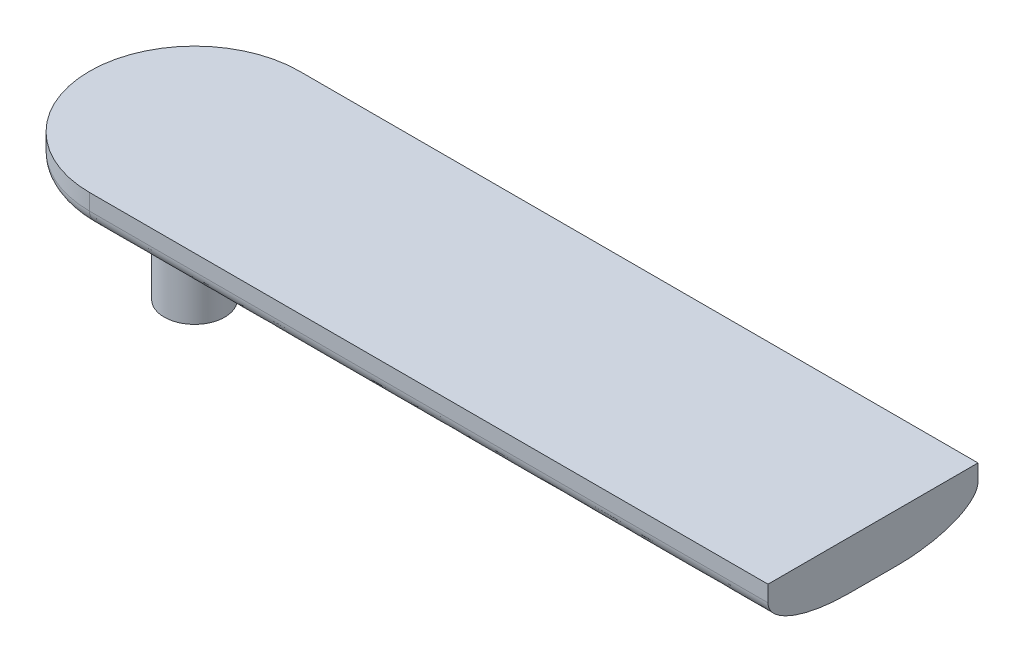
from build123d import *

# Parameters (mm, degrees)
BOSS_EXTRUDE1_DEPTH = 3
FILLET1_SIZE        = 2
FILLET1_SIZE_2      = 5
SKETCH2_R           = 1.875
SKETCH2_R_2         = 0.875
BOSS_EXTRUDE3_DEPTH = 9
CUT_EXTRUDE2_START  = -0.5
SKETCH4_R           = 0.875
CUT_EXTRUDE2_DEPTH  = 43.942490853


with BuildPart() as part:
    # Sketch1 → Boss-Extrude1 (new body)
    with BuildSketch(Plane(origin=(0, 0, 0), x_dir=(1, 0, 0), z_dir=(0, 1, 0))):
        with BuildLine():
            Line((0, 6.5), (42, 6.5))
            Line((42, 6.5), (42, -6.5))
            Line((42, -6.5), (0, -6.5))
            ThreePointArc((0, -6.5), (-6.5, 0), (0, 6.5))
        make_face()
    extrude(amount=BOSS_EXTRUDE1_DEPTH)

    # Fillet1
    # an asymmetric fillet: 5, 2 mm, written as the material it takes off along each edge
    with BuildSketch(Plane(origin=(0, 0, -6.5), x_dir=(0, 1, 0), z_dir=(1, 0, 0)), Plane(origin=(54.5, 0, 6.5), x_dir=(0, 1, 0), z_dir=(-1, 0, 0))) as fillet1_piece_1:
        with BuildLine():
            Bezier((FILLET1_SIZE, 0), (0, 0), (0, FILLET1_SIZE_2), weights=[1, 0.707106781, 1])
            Line((0, FILLET1_SIZE_2), (0, 0))
            Line((0, 0), (FILLET1_SIZE, 0))
        make_face()
    extrude(amount=54.5, mode=Mode.SUBTRACT)
    with BuildSketch(Plane(origin=(0, 0, 0), x_dir=(0, 0, 1), z_dir=(1, 0, 0))) as fillet1_piece_2:
        with BuildLine():
            Bezier((6.5, -FILLET1_SIZE), (6.5, 0), (6.5 - FILLET1_SIZE_2, 0), weights=[1, 0.707106781, 1])
            Line((6.5 - FILLET1_SIZE_2, 0), (6.5, 0))
            Line((6.5, 0), (6.5, -FILLET1_SIZE))
        make_face()
    revolve(axis=Axis((0, 0, 0), (0, -1, 0)), revolution_arc=180, mode=Mode.SUBTRACT)

    # Sketch2 → Boss-Extrude3 (add)
    with BuildSketch(Plane(origin=(0, 3, 0), x_dir=(1, 0, 0), z_dir=(0, 1, 0))):
        with Locations(Location((0, 0, 0), (0, 0, 270))):
            Circle(SKETCH2_R)
        with Locations(Location((0, 0, 0), (0, 0, 270))):
            Circle(SKETCH2_R_2, mode=Mode.SUBTRACT)
    extrude(amount=-BOSS_EXTRUDE3_DEPTH)

    # Sketch4 → Cut-Extrude2 (cut, through all)
    with BuildSketch(Plane(origin=(0, 3, 0), x_dir=(1, 0, 0), z_dir=(0, 1, 0)).offset(CUT_EXTRUDE2_START)):
        with Locations(Location((0, 0, 0), (0, 0, 270))):
            Circle(SKETCH4_R)
    extrude(amount=-CUT_EXTRUDE2_DEPTH, mode=Mode.SUBTRACT)


solid = part.part
